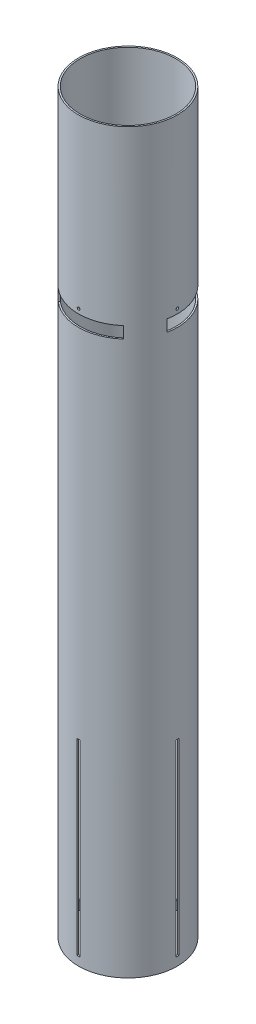
from build123d import *

# Parameters (mm, degrees)
SKETCH1_R           = 51.1048
SKETCH1_R_2         = 49.53
BOSS_EXTRUDE1_DEPTH = 762
CUT_EXTRUDE1_DEPTH  = 766.419754884
CIRPATTERN1_COUNT   = 4
CUT_EXTRUDE2_DEPTH  = 766.419754884
CIRPATTERN2_COUNT   = 4
SKETCH3_R           = 3.175
CUT_EXTRUDE3_DEPTH  = 766.419754997
CUT_EXTRUDE4_START  = -12.065
CUT_EXTRUDE4_DEPTH  = 12.065
CIRPATTERN3_COUNT   = 3


with BuildPart() as part:
    # Sketch1 → Boss-Extrude1 (new body)
    with BuildSketch(Plane(origin=(0, 0, 0), x_dir=(1, 0, 0), z_dir=(0, 1, 0))):
        Circle(SKETCH1_R)
        Circle(SKETCH1_R_2, mode=Mode.SUBTRACT)
    extrude(amount=BOSS_EXTRUDE1_DEPTH)

    # Sketch2 → Cut-Extrude1 (cut, through all)
    with BuildSketch(Plane(origin=(0, 0, 0), x_dir=(0, 0, -1), z_dir=(1, 0, 0))):
        Polygon((0, 8.89), (1.5875, 8.89), (1.5875, 203.2), (-1.5875, 203.2), (-1.5875, 8.89), align=None)
    cut_extrude1 = extrude(amount=-CUT_EXTRUDE1_DEPTH, mode=Mode.SUBTRACT)

    # CirPattern1: Cut-Extrude1 ×4 about axis
    cirpattern1_axis = Axis((0, 0, 0), (0, 1, 0))
    for i in range(1, CIRPATTERN1_COUNT):
        add(cut_extrude1.rotate(cirpattern1_axis, i * 360 / CIRPATTERN1_COUNT), mode=Mode.SUBTRACT)

    # Sketch2<3> → Cut-Extrude2 (cut, through all)
    with BuildSketch(Plane(origin=(0, 0, 0), x_dir=(0, 0, -1), z_dir=(1, 0, 0))):
        with BuildLine():
            ThreePointArc((0, 589.99755), (-0.956397277, 587.688602723), (1.35255, 588.645))
            ThreePointArc((1.35255, 588.645), (0.956397277, 589.601397277), (0, 589.99755))
        make_face()
    cut_extrude2 = extrude(amount=-CUT_EXTRUDE2_DEPTH, mode=Mode.SUBTRACT)

    # CirPattern2: Cut-Extrude2 ×4 about axis
    cirpattern2_axis = Axis((0, 762, 0), (0, -1, 0))
    for i in range(1, CIRPATTERN2_COUNT):
        add(cut_extrude2.rotate(cirpattern2_axis, i * 360 / CIRPATTERN2_COUNT), mode=Mode.SUBTRACT)

    # Sketch3 → Cut-Extrude3 (cut, through all)
    with BuildSketch(Plane(origin=(0, 0, 0), x_dir=(0.7071067811865477, 0, -0.7071067811865475), z_dir=(0.7071067811865475, 0, 0.7071067811865477))):
        with Locations((0, 127)):
            Circle(SKETCH3_R)
    extrude(amount=-CUT_EXTRUDE3_DEPTH, mode=Mode.SUBTRACT)

    # Sketch7 → Cut-Extrude4 (cut)
    with BuildSketch(Plane(origin=(0, 583.8825, 0), x_dir=(1, 0, 0), z_dir=(0, 1, 0)).offset(CUT_EXTRUDE4_START)):
        with BuildLine():
            Line((-50.122835598, -9.970051889), (-48.578294938, -9.662823649))
            ThreePointArc((-48.578294938, -9.662823649), (-42.894238249, 24.765), (-15.920896716, 46.901449314))
            Line((-15.920896716, 46.901449314), (-16.427099586, 48.392674882))
            ThreePointArc((-16.427099586, 48.392674882), (-41.142779675, 30.31455531), (-51.086898433, 1.35255))
            ThreePointArc((-51.086898433, 1.35255), (-51.1048, 0), (-51.086898433, -1.35255))
            ThreePointArc((-51.086898433, -1.35255), (-50.787970036, -5.681785166), (-50.122835598, -9.970051889))
        make_face()
    cut_extrude4 = extrude(amount=CUT_EXTRUDE4_DEPTH, mode=Mode.SUBTRACT)

    # CirPattern3: Cut-Extrude4 ×3 about axis
    cirpattern3_axis = Axis((0, 762, 0), (0, -1, 0))
    for i in range(1, CIRPATTERN3_COUNT):
        add(cut_extrude4.rotate(cirpattern3_axis, i * 360 / CIRPATTERN3_COUNT), mode=Mode.SUBTRACT)


solid = part.part
